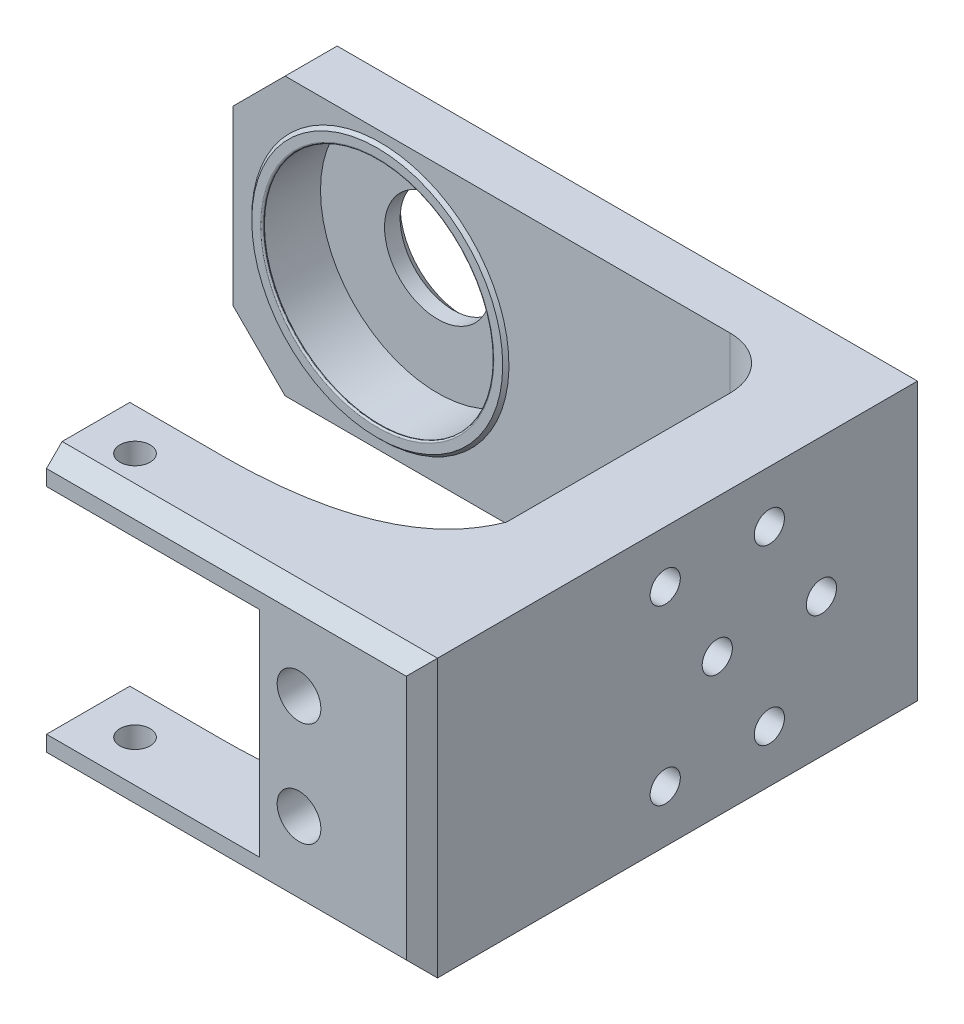
from build123d import *

# Parameters (mm, degrees)
CROQUIS1_W                 = 56.1
CROQUIS1_H                 = 26.6
CROQUIS1_R                 = 2.1
CROQUIS1_W_2               = 40.9
CROQUIS1_H_2               = 20.6
SALIENTE_EXTRUIR1_DEPTH    = 8
CROQUIS2_W                 = 50.6
CROQUIS2_H                 = 26.6
SALIENTE_EXTRUIR2_DEPTH    = 8
CROQUIS3_W                 = 60.73602496
CROQUIS3_H                 = 26.6
SALIENTE_EXTRUIR3_DEPTH    = 8
CROQUIS4_R                 = 11.25
CORTAR_EXTRUIR1_DEPTH      = 5.5
CROQUIS5_R                 = 5.1
CORTAR_EXTRUIR2_DEPTH      = 62.563808362
CROQUIS6_R                 = 12.05
CROQUIS6_R_2               = 11.05
SALIENTE_EXTRUIR4_DEPTH    = 0.3
CHAFL_N1_SIZE              = 0.3
REDONDEO1_R                = 0.15
CHAFL_N2_SIZE              = 5
CORTAR_EXTRUIR5_REACH      = 65.536
CROQUIS11_W                = 30.047801794
CROQUIS11_H                = 26.6
CROQUIS12_R                = 1.45
CORTAR_EXTRUIR6_DEPTH      = 62.821699265
CHAFL_N8_SIZE              = 3
CHAFL_N9_SIZE              = 1
CHAFL_N10_SIZE             = 1.5
SALIENTE_EXTRUIR7_DEPTH    = 3
REDONDEO3_R                = 5
CROQUIS14_R                = 1.45
CORTAR_EXTRUIR7_DEPTH      = 70.085008007
CORTAR_EXTRUIR8_DEPTH      = 70.085008007
CORTAR_EXTRUIR8_DEPTH_BACK = 70.085008007
CROQUIS15_R                = 1.45


with BuildPart() as part:
    # Croquis1 → Saliente-Extruir1 (new body)
    with BuildSketch(Plane.XY):
        Rectangle(CROQUIS1_W, CROQUIS1_H)
        with Locations((24.250000128, -5)):
            Circle(CROQUIS1_R, mode=Mode.SUBTRACT)
        with Locations((24.250000128, 5)):
            Circle(CROQUIS1_R, mode=Mode.SUBTRACT)
        with Locations((-24.249999872, -5)):
            Circle(CROQUIS1_R, mode=Mode.SUBTRACT)
        with Locations((-24.249999872, 5)):
            Circle(CROQUIS1_R, mode=Mode.SUBTRACT)
        Rectangle(CROQUIS1_W_2, CROQUIS1_H_2, mode=Mode.SUBTRACT)
    extrude(amount=SALIENTE_EXTRUIR1_DEPTH)

    # Croquis2 → Saliente-Extruir2 (add)
    with BuildSketch(Plane(origin=(28.05, 0, 0), x_dir=(0, 0, -1), z_dir=(1, 0, 0))):
        with Locations((17.3, 0)):
            Rectangle(CROQUIS2_W, CROQUIS2_H)
    extrude(amount=SALIENTE_EXTRUIR2_DEPTH)

    # Croquis3 → Saliente-Extruir3 (add)
    with BuildSketch(Plane(origin=(0, 0, -42.6), x_dir=(-1, 0, 0), z_dir=(0, 0, -1))):
        with Locations((-5.68198752, 0)):
            Rectangle(CROQUIS3_W, CROQUIS3_H)
    extrude(amount=-SALIENTE_EXTRUIR3_DEPTH)

    # Croquis4 → Cortar-Extruir1 (cut)
    with BuildSketch(Plane.XY.offset(-34.6)):
        with Locations((-10.53602496, 0)):
            Circle(CROQUIS4_R)
    extrude(amount=-CORTAR_EXTRUIR1_DEPTH, mode=Mode.SUBTRACT)

    # Croquis5 → Cortar-Extruir2 (cut, through all)
    with BuildSketch(Plane.XY.offset(-40.1)):
        with Locations((-10.53602496, 0)):
            Circle(CROQUIS5_R)
    extrude(amount=-CORTAR_EXTRUIR2_DEPTH, mode=Mode.SUBTRACT)

    # Croquis6 → Saliente-Extruir4 (add)
    with BuildSketch(Plane.XY.offset(-34.6)):
        with Locations((-10.53602496, 0)):
            Circle(CROQUIS6_R)
        with Locations((-10.53602496, 0)):
            Circle(CROQUIS6_R_2, mode=Mode.SUBTRACT)
    extrude(amount=SALIENTE_EXTRUIR4_DEPTH)

    # Chaflán1
    chafl_n1_edges = [part.edges().sort_by_distance(p)[0] for p in [
        (-22.58602496, 0, -34.6),
    ]]
    chamfer(chafl_n1_edges, length=CHAFL_N1_SIZE - 0.0001)  # a hair under: the kernel refuses the full size

    # Redondeo1
    redondeo1_edges = [part.edges().sort_by_distance(p)[0] for p in [
        (-21.58602496, 0, -34.6),
        (-21.58602496, 0, -34.3),
    ]]
    fillet(redondeo1_edges, radius=REDONDEO1_R - 0.0001)  # a hair under: the kernel refuses the full size

    # Chaflán2
    chafl_n2_edges = [part.edges().sort_by_distance(p)[0] for p in [
        (-24.68602496, -13.3, -38.6),
        (-24.68602496, 13.3, -38.6),
    ]]
    chamfer(chafl_n2_edges, length=CHAFL_N2_SIZE)

    # Croquis11 → Cortar-Extruir5 (cut, up to next)
    with BuildSketch(Plane.XY.offset(8), mode=Mode.PRIVATE) as cortar_extruir5_sk1:
        with Locations((-15.023900897, 0)):
            Rectangle(CROQUIS11_W, CROQUIS11_H)
    cortar_extruir5_tool1 = extrude(cortar_extruir5_sk1.sketch, amount=-CORTAR_EXTRUIR5_REACH, mode=Mode.PRIVATE) & part.part
    add(cortar_extruir5_tool1.solids().sort_by_distance((-15.023901, 0, 8))[0], mode=Mode.SUBTRACT)

    # Croquis12 → Cortar-Extruir6 (cut, through all)
    with BuildSketch(Plane(origin=(0, -13.3, 0), x_dir=(-1, 0, 0), z_dir=(0, -1, 0))):
        with Locations(Location((-4.5, -4, 0), (0, 0, 90))):
            Circle(CROQUIS12_R)
    extrude(amount=-CORTAR_EXTRUIR6_DEPTH, mode=Mode.SUBTRACT)

    # Chaflán8
    chafl_n8_edges = [part.edges().sort_by_distance(p)[0] for p in [
        (-24.68602496, 0, -42.6),
        (-22.18602496, -10.8, -42.6),
        (-22.18602496, 10.8, -42.6),
        (8.18198752, -13.3, -42.6),
        (8.18198752, 13.3, -42.6),
        (36.05, 0, -42.6),
    ]]
    chamfer(chafl_n8_edges, length=CHAFL_N8_SIZE)

    # Chaflán9
    chafl_n9_edges = [part.edges().sort_by_distance(p)[0] for p in [
        (-15.63602496, 0, -42.6),
    ]]
    chamfer(chafl_n9_edges, length=CHAFL_N9_SIZE)

    # Chaflán10
    chafl_n10_edges = [part.edges().sort_by_distance(p)[0] for p in [
        (18.025, -13.3, 8),
        (36.05, 0, 8),
        (18.025, 13.3, 8),
    ]]
    chamfer(chafl_n10_edges, length=CHAFL_N10_SIZE)

    # Croquis13 → Saliente-Extruir7 (add)
    with BuildSketch(Plane(origin=(0, 13.3, 0), x_dir=(1, 0, 0), z_dir=(0, 1, 0))):
        with BuildLine():
            Line((28.05, 8.144334064), (28.05, 0))
            Line((28.05, 0), (9, 0))
            add(Edge.make_bspline(
                [(9, 0), (24.941361066, 0.053648998), (28.05, 8.144334064)],
                knots=[0, 0, 0, 0.673633708, 0.673633708, 0.673633708], degree=2))
        make_face()
    saliente_extruir7 = extrude(amount=-SALIENTE_EXTRUIR7_DEPTH)

    # Simetría7: Saliente-Extruir7 across plane
    add(saliente_extruir7.mirror(Plane.ZX))

    # Redondeo3
    redondeo3_edges = [part.edges().sort_by_distance(p)[0] for p in [
        (28.05, 0, -34.6),
    ]]
    fillet(redondeo3_edges, radius=REDONDEO3_R)

    # Croquis14 → Cortar-Extruir7 (cut, through all)
    with BuildSketch(Plane.ZY.offset(-28.05)):
        with Locations((-15.372167032, -8.3)):
            Circle(CROQUIS14_R)
        with Locations((-25.372167032, -8.3)):
            Circle(CROQUIS14_R)
    cortar_extruir7 = extrude(amount=-CORTAR_EXTRUIR7_DEPTH, mode=Mode.SUBTRACT)

    # Simetría8: Cortar-Extruir7 across plane
    add(cortar_extruir7.mirror(Plane.ZX), mode=Mode.SUBTRACT)

    # Croquis15 → Cortar-Extruir8 (cut, two sides: drawn at the far end of the back side and taken through both)
    with BuildSketch(Plane.ZY.offset(-28.05).offset(-CORTAR_EXTRUIR8_DEPTH_BACK)):
        with Locations((-20.372167032, 0)):
            Circle(CROQUIS15_R)
        with Locations((-30.372167032, 0)):
            Circle(CROQUIS15_R)
    extrude(amount=CORTAR_EXTRUIR8_DEPTH + CORTAR_EXTRUIR8_DEPTH_BACK, mode=Mode.SUBTRACT)


solid = part.part
